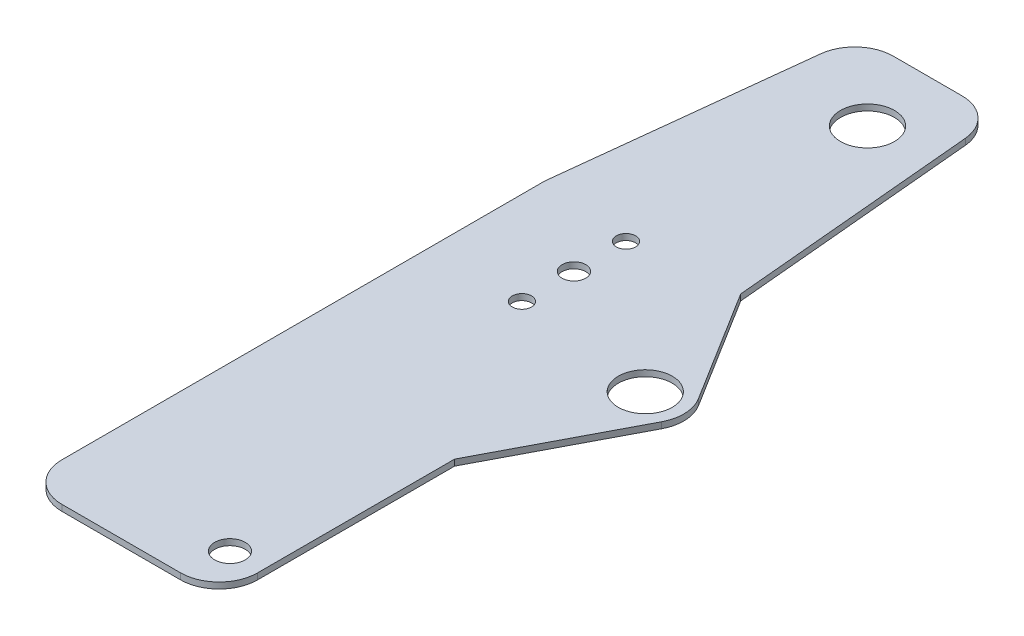
from build123d import *

# Parameters (mm, degrees)
SKETCH1_R           = 2.5
SKETCH1_R_2         = 3.960069723
SKETCH1_R_3         = 3.063716144
SKETCH1_R_4         = 7
BOSS_EXTRUDE1_DEPTH = 1.5875
SKETCH4_W           = 66.272407177
SKETCH4_H           = 27.800260981
CUT_EXTRUDE2_DEPTH  = 20
FILLET3_R           = 10
FILLET4_R           = 10
BOSS_EXTRUDE3_START = -1.5875
BOSS_EXTRUDE3_DEPTH = 1.5875
SKETCH7_R           = 7
CUT_EXTRUDE3_DEPTH  = 1.5875


with BuildPart() as part:
    # Sketch1 → Boss-Extrude1 (new body)
    with BuildSketch(Plane(origin=(0, 0, 0), x_dir=(1, 0, 0), z_dir=(0, 1, 0))):
        with BuildLine():
            Line((42.32729629, 228.6), (10.454309325, 228.6))
            Line((10.454309325, 228.6), (0, 135.362739137))
            Line((0, 135.362739137), (0, 0))
            Line((0, 0), (24.327009544, 0))
            Line((24.327009544, 0), (50.8, 0))
            Line((50.8, 0), (50.8, 64.87909603))
            Line((50.8, 64.87909603), (50.8, 87.423477361))
            Line((50.8, 87.423477361), (50.8, 98.200996728))
            ThreePointArc((50.8, 98.200996728), (50.4, 101.000996728), (50.8, 103.800996728))
            Line((50.8, 103.800996728), (50.8, 104.488200565))
            Line((50.8, 104.488200565), (50.8, 120.619222808))
            Line((50.8, 120.619222808), (50.8, 135.362739137))
            Line((50.8, 135.362739137), (42.32729629, 228.6))
        make_face()
        with Locations((24.101759227, 105.284935242)):
            Circle(SKETCH1_R, mode=Mode.SUBTRACT)
        with Locations((42.32729629, 11.29561028)):
            Circle(SKETCH1_R_2, mode=Mode.SUBTRACT)
        with Locations((24.101759227, 118.784935242)):
            Circle(SKETCH1_R_3, mode=Mode.SUBTRACT)
        with Locations((24.101759227, 132.284935242)):
            Circle(SKETCH1_R, mode=Mode.SUBTRACT)
        with Locations((29.504213454, 189.557234372)):
            Circle(SKETCH1_R_4, mode=Mode.SUBTRACT)
    extrude(amount=BOSS_EXTRUDE1_DEPTH)

    # Sketch4 → Cut-Extrude2 (cut)
    with BuildSketch(Plane(origin=(0, 0, -228.6), x_dir=(-1, 0, 0), z_dir=(0, 0, -1))):
        with Locations((-28.174690156, -1.980940155)):
            Rectangle(SKETCH4_W, SKETCH4_H)
    extrude(amount=-CUT_EXTRUDE2_DEPTH, mode=Mode.SUBTRACT)

    # Fillet3
    fillet3_edges = [part.edges().sort_by_distance(p)[0] for p in [
        (44.144746445, 0.79375, -208.6),
    ]]
    fillet(fillet3_edges, radius=FILLET3_R)

    # Fillet4
    fillet4_edges = [part.edges().sort_by_distance(p)[0] for p in [
        (50.8, 0.79375, 0),
        (0, 0.79375, 0),
        (8.211791854, 0.79375, -208.6),
    ]]
    fillet(fillet4_edges, radius=FILLET4_R)

    # Sketch6 → Boss-Extrude3 (add)
    with BuildSketch(Plane(origin=(0, 1.5875, 0), x_dir=(1, 0, 0), z_dir=(0, 1, 0)).offset(BOSS_EXTRUDE3_START)):
        with BuildLine():
            Line((50.8, 135.362739137), (50.8, 103.800996728))
            ThreePointArc((50.8, 103.800996728), (50.4, 101.000996728), (50.8, 98.200996728))
            Line((50.8, 98.200996728), (50.8, 61.124243317))
            Line((50.8, 61.124243317), (69.258211507, 96.360728536))
            ThreePointArc((69.258211507, 96.360728536), (70.393157133, 101.370875786), (68.890940865, 106.283413148))
            Line((68.890940865, 106.283413148), (50.8, 135.362739137))
        make_face()
    extrude(amount=BOSS_EXTRUDE3_DEPTH)

    # Sketch7 → Cut-Extrude3 (cut)
    with BuildSketch(Plane(origin=(0, 1.5875, 0), x_dir=(1, 0, 0), z_dir=(0, 1, 0))):
        with Locations((60.4, 101.000996728)):
            Circle(SKETCH7_R)
    extrude(amount=-CUT_EXTRUDE3_DEPTH, mode=Mode.SUBTRACT)


solid = part.part
